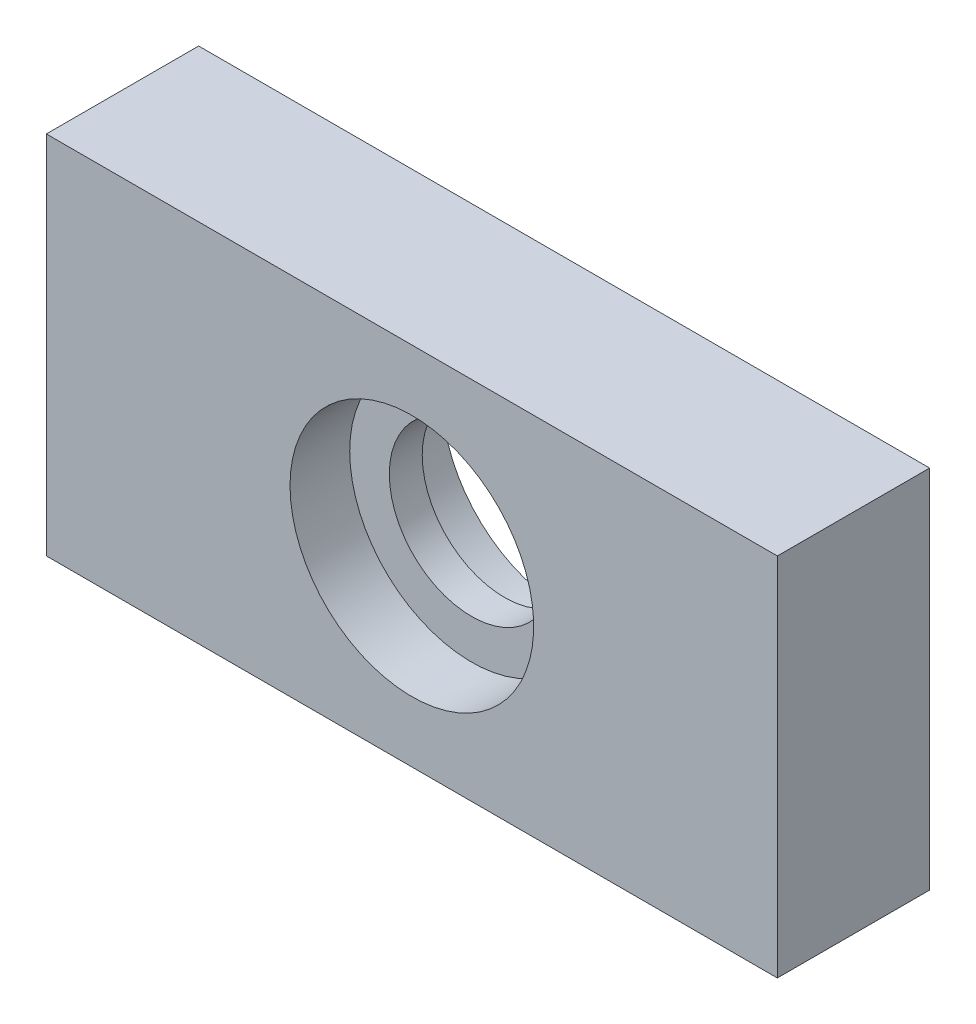
from build123d import *

# Parameters (mm, degrees)
SKETCH1_W           = 152.4
SKETCH1_H           = 76.2
BOSS_EXTRUDE1_DEPTH = 31.75
SKETCH2_R           = 17.145
CUT_EXTRUDE1_DEPTH  = 174.321269612
SKETCH2_2_R         = 25.4
SKETCH2_2_R_2       = 17.145
CUT_EXTRUDE3_DEPTH  = 12.446


with BuildPart() as part:
    # Sketch1 → Boss-Extrude1 (new body)
    with BuildSketch(Plane.XY):
        with Locations((76.2, 38.1)):
            Rectangle(SKETCH1_W, SKETCH1_H)
    extrude(amount=BOSS_EXTRUDE1_DEPTH)

    # Sketch2 → Cut-Extrude1 (cut, through all)
    with BuildSketch(Plane(origin=(0, 0, 0), x_dir=(-1, 0, 0), z_dir=(0, 0, -1))):
        with Locations((-76.2, 38.1)):
            Circle(SKETCH2_R)
    extrude(amount=-CUT_EXTRUDE1_DEPTH, mode=Mode.SUBTRACT)

    # Sketch2<2> → Cut-Extrude3 (cut)
    with BuildSketch(Plane(origin=(0, 0, 0), x_dir=(-1, 0, 0), z_dir=(0, 0, -1))):
        with Locations((-76.2, 38.1)):
            Circle(SKETCH2_2_R)
        with Locations((-76.2, 38.1)):
            Circle(SKETCH2_2_R_2, mode=Mode.SUBTRACT)
    cut_extrude3 = extrude(amount=-CUT_EXTRUDE3_DEPTH, mode=Mode.SUBTRACT)

    # Mirror2: Cut-Extrude3 across plane
    add(cut_extrude3.mirror(Plane(origin=(0, 0, 15.875), x_dir=(1, 0, 0), z_dir=(0, 0, -1))), mode=Mode.SUBTRACT)


solid = part.part
